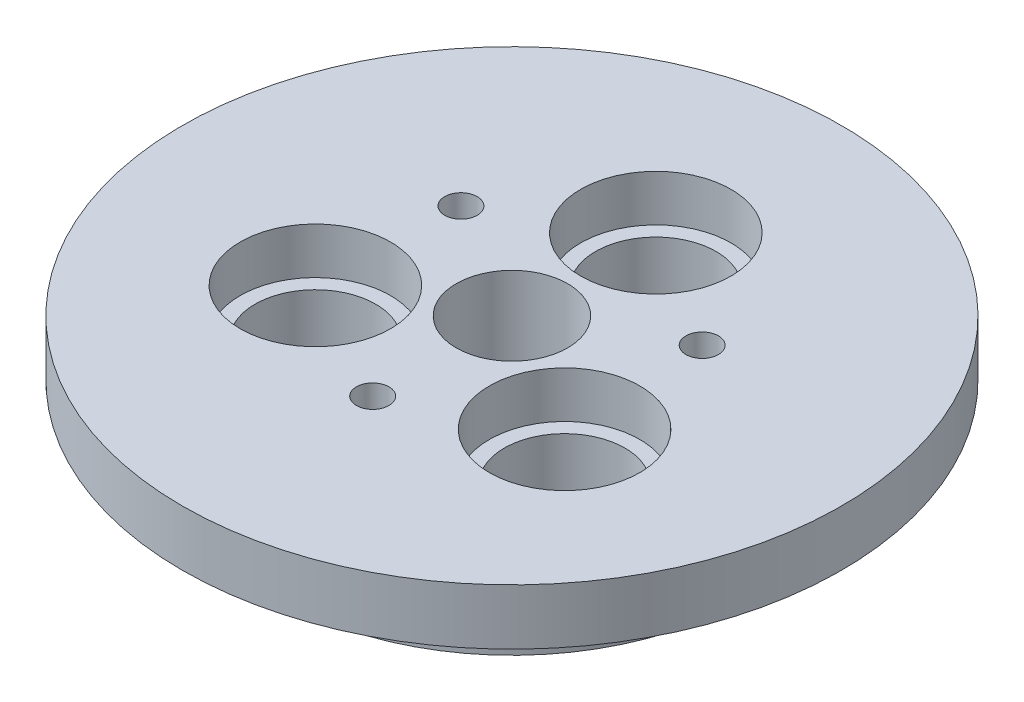
from build123d import *

# Parameters (mm, degrees)
SKETCH1_R               = 35.5
BOSS_EXTRUDE1_DEPTH     = 3
SKETCH2_R               = 26
BOSS_EXTRUDE2_DEPTH     = 1
SKETCH3_R               = 25
BOSS_EXTRUDE3_DEPTH     = 19
SKETCH5_R               = 6
CUT_EXTRUDE2_DEPTH      = 57.53759811
SKETCH6_R               = 30.018937713
SKETCH6_R_2             = 20
CUT_EXTRUDE3_DEPTH      = 12
CHAMFER2_SIZE           = 2.5
BOSS_EXTRUDE4_START     = 8
SKETCH8_R               = 25
BOSS_EXTRUDE4_DEPTH     = 8
SKETCH10_R              = 6
CUT_EXTRUDE6_DEPTH      = 61.634148794
SKETCH7_R               = 1.75
CUT_EXTRUDE4_DEPTH      = 61.634148794
BOSS_EXTRUDE5_START     = 1
SKETCH11_R              = 26
SKETCH11_R_2            = 25
BOSS_EXTRUDE5_DEPTH     = 1
CHAMFER1_SIZE           = 1
CUT_EXTRUDE7_DEPTH      = 56.222278113
CUT_EXTRUDE7_DEPTH_BACK = 56.222278113
SKETCH12_W              = 92.25680519
SKETCH12_H              = 27.524612869
SKETCH14_R              = 8.1
CUT_EXTRUDE8_DEPTH      = 5
SKETCH15_R              = 6.5
CUT_EXTRUDE9_DEPTH      = 52.004901725


with BuildPart() as part:
    # Sketch1 → Boss-Extrude1 (new, symmetric)
    with BuildSketch(Plane(origin=(0, 0, 0), x_dir=(1, 0, 0), z_dir=(0, 1, 0))):
        with Locations(Location((0, 0, 0), (0, 0, 270))):
            Circle(SKETCH1_R)
    extrude(amount=BOSS_EXTRUDE1_DEPTH, both=True)

    # Sketch2 → Boss-Extrude2 (add)
    with BuildSketch(Plane(origin=(0, 3, 0), x_dir=(1, 0, 0), z_dir=(0, 1, 0))):
        with Locations(Location((0, 0, 0), (0, 0, 270))):
            Circle(SKETCH2_R)
    extrude(amount=BOSS_EXTRUDE2_DEPTH)

    # Sketch3 → Boss-Extrude3 (add)
    with BuildSketch(Plane(origin=(0, 4, 0), x_dir=(1, 0, 0), z_dir=(0, 1, 0))):
        with Locations(Location((0, 0, 0), (0, 0, 270))):
            Circle(SKETCH3_R)
    extrude(amount=BOSS_EXTRUDE3_DEPTH)

    # Sketch5 → Cut-Extrude2 (cut, through all)
    with BuildSketch(Plane(origin=(0, 23, 0), x_dir=(1, 0, 0), z_dir=(0, 1, 0))):
        with Locations(Location((0, 0, 0), (0, 0, 270))):
            Circle(SKETCH5_R)
    extrude(amount=-CUT_EXTRUDE2_DEPTH, mode=Mode.SUBTRACT)

    # Sketch6 → Cut-Extrude3 (cut)
    with BuildSketch(Plane(origin=(0, 23, 0), x_dir=(1, 0, 0), z_dir=(0, 1, 0))):
        Circle(SKETCH6_R)
        with Locations(Location((0, 0, 0), (0, 0, 270))):
            Circle(SKETCH6_R_2, mode=Mode.SUBTRACT)
    extrude(amount=-CUT_EXTRUDE3_DEPTH, mode=Mode.SUBTRACT)

    # Chamfer2
    chamfer2_edges = [part.edges().sort_by_distance(p)[0] for p in [
        (0, 11, -20),
    ]]
    chamfer(chamfer2_edges, length=CHAMFER2_SIZE)

    # Sketch8 → Boss-Extrude4 (add)
    with BuildSketch(Plane.XZ.offset(3).offset(BOSS_EXTRUDE4_START)):
        with Locations(Location((0, 0, 0), (0, 0, 90))):
            Circle(SKETCH8_R)
    extrude(amount=-BOSS_EXTRUDE4_DEPTH)

    # Sketch10 → Cut-Extrude6 (cut, through all)
    with BuildSketch(Plane.XZ.offset(11)):
        with Locations(Location((0, 0, 0), (0, 0, 90))):
            Circle(SKETCH10_R)
    extrude(amount=-CUT_EXTRUDE6_DEPTH, mode=Mode.SUBTRACT)

    # Sketch7 → Cut-Extrude4 (cut, through all)
    with BuildSketch(Plane(origin=(0, 23, 0), x_dir=(1, 0, 0), z_dir=(0, 1, 0))):
        with Locations(Location((0, -15, 0), (0, 0, 270))):
            Circle(SKETCH7_R)
        with Locations(Location((-12.990381057, 7.5, 0), (0, 0, 270))):
            Circle(SKETCH7_R)
        with Locations(Location((12.990381057, 7.5, 0), (0, 0, 270))):
            Circle(SKETCH7_R)
    extrude(amount=-CUT_EXTRUDE4_DEPTH, mode=Mode.SUBTRACT)

    # Sketch11 → Boss-Extrude5 (add)
    with BuildSketch(Plane.XZ.offset(3).offset(BOSS_EXTRUDE5_START)):
        with Locations(Location((0, 0, 0), (0, 0, 90))):
            Circle(SKETCH11_R)
        with Locations(Location((0, 0, 0), (0, 0, 90))):
            Circle(SKETCH11_R_2, mode=Mode.SUBTRACT)
    extrude(amount=-BOSS_EXTRUDE5_DEPTH)

    # Chamfer1
    chamfer1_edges = [part.edges().sort_by_distance(p)[0] for p in [
        (0, 3, -26),
        (0, -3, -26),
    ]]
    chamfer(chamfer1_edges, length=CHAMFER1_SIZE - 0.0001)  # a hair under: the kernel refuses the full size

    # Sketch12 → Cut-Extrude7 (cut, two sides: drawn at the far end of the back side and taken through both)
    with BuildSketch(Plane.XY.offset(-CUT_EXTRUDE7_DEPTH_BACK)):
        with Locations((2.130775151, 16.762306435)):
            Rectangle(SKETCH12_W, SKETCH12_H)
    extrude(amount=CUT_EXTRUDE7_DEPTH + CUT_EXTRUDE7_DEPTH_BACK, mode=Mode.SUBTRACT)

    # Sketch14 → Cut-Extrude8 (cut)
    with BuildSketch(Plane(origin=(0, 3, 0), x_dir=(1, 0, 0), z_dir=(0, 1, 0))):
        with Locations(Location((0, 15.5, 0), (0, 0, 270))):
            Circle(SKETCH14_R)
        with Locations(Location((13.423393759, -7.75, 0), (0, 0, 270))):
            Circle(SKETCH14_R)
        with Locations(Location((-13.423393759, -7.75, 0), (0, 0, 270))):
            Circle(SKETCH14_R)
    extrude(amount=-CUT_EXTRUDE8_DEPTH, mode=Mode.SUBTRACT)

    # Sketch15 → Cut-Extrude9 (cut, through all)
    with BuildSketch(Plane(origin=(0, -2, 0), x_dir=(1, 0, 0), z_dir=(0, 1, 0))):
        with Locations(Location((0, 15.5, 0), (0, 0, 270))):
            Circle(SKETCH15_R)
        with Locations(Location((13.423393759, -7.75, 0), (0, 0, 270))):
            Circle(SKETCH15_R)
        with Locations(Location((-13.423393759, -7.75, 0), (0, 0, 270))):
            Circle(SKETCH15_R)
    extrude(amount=-CUT_EXTRUDE9_DEPTH, mode=Mode.SUBTRACT)


solid = part.part
